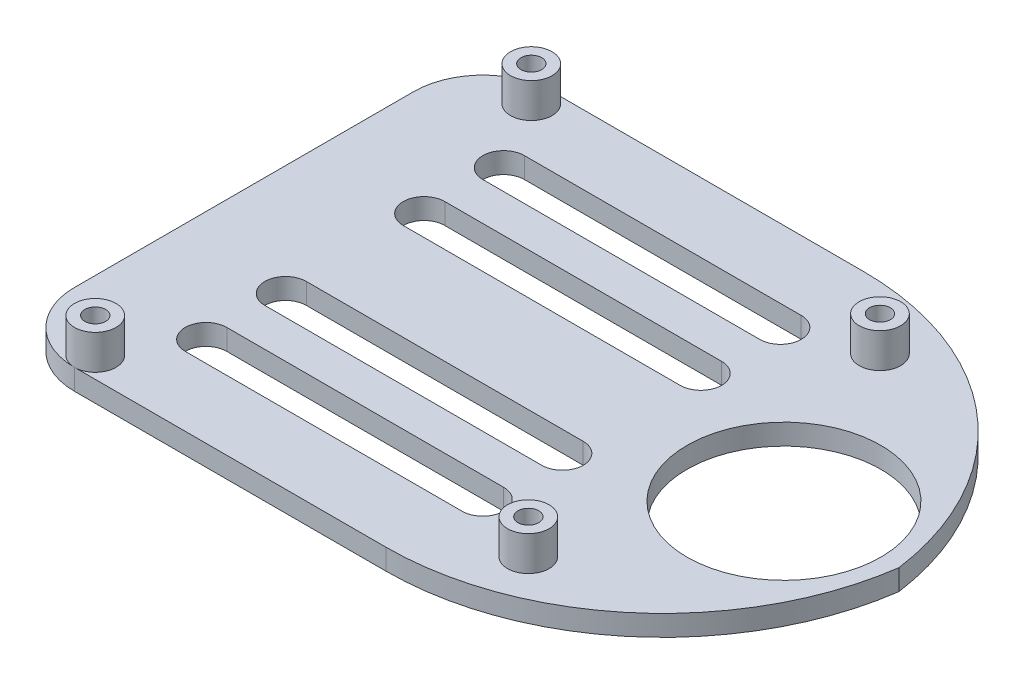
from build123d import *

# Parameters (mm, degrees)
ESBO_O1_W                = 95
ESBO_O1_H                = 69
RESSALTO_EXTRUS_O1_DEPTH = 3
ESBO_O2_R                = 14
CORTE_EXTRUS_O1_DEPTH    = 59.783501087
ESBO_O4_R                = 1
CORTE_EXTRUS_O2_DEPTH    = 59.783501087
ESBO_O5_R                = 3
ESBO_O5_R_2              = 1.5
RESSALTO_EXTRUS_O2_DEPTH = 5
FILETE1_R                = 40
FILETE2_R                = 10
CORTE_EXTRUS_O3_DEPTH    = 59.919436521


with BuildPart() as part:
    # Esboço1 → Ressalto-extrusão1 (new body)
    with BuildSketch(Plane(origin=(0, 0, 0), x_dir=(1, 0, 0), z_dir=(0, 1, 0))):
        Rectangle(ESBO_O1_W, ESBO_O1_H)
    extrude(amount=RESSALTO_EXTRUS_O1_DEPTH)

    # Esboço2 → Corte-extrusão1 (cut, through all)
    with BuildSketch(Plane(origin=(0, 3, 0), x_dir=(1, 0, 0), z_dir=(0, 1, 0))):
        with Locations(Location((30.5, 0, 0), (0, 0, 270))):
            Circle(ESBO_O2_R)
    extrude(amount=-CORTE_EXTRUS_O1_DEPTH, mode=Mode.SUBTRACT)

    # Esboço4 → Corte-extrusão2 (cut, through all)
    with BuildSketch(Plane(origin=(0, 3, 0), x_dir=(1, 0, 0), z_dir=(0, 1, 0))):
        with Locations(Location((18.971497235, 25.4, 0), (0, 0, 270))):
            Circle(ESBO_O4_R)
        with Locations(Location((18.971497235, -25.4, 0), (0, 0, 90))):
            Circle(ESBO_O4_R)
        with Locations(Location((-37.5, 31.5, 0), (0, 0, 270))):
            Circle(ESBO_O4_R)
        with Locations(Location((-37.5, -31.5, 0), (0, 0, 90))):
            Circle(ESBO_O4_R)
    extrude(amount=-CORTE_EXTRUS_O2_DEPTH, mode=Mode.SUBTRACT)

    # Esboço5 → Ressalto-extrusão2 (add)
    # profile 1 of 4: a face of its own
    with BuildSketch(Plane(origin=(0, 3, 0), x_dir=(1, 0, 0), z_dir=(0, 1, 0))):
        with Locations(Location((-37.5, 31.5, 0), (0, 0, 90))):
            Circle(ESBO_O5_R)
        with Locations(Location((-37.5, 31.5, 0), (0, 0, 270))):
            Circle(ESBO_O5_R_2, mode=Mode.SUBTRACT)
    # profile 2 of 4: a face of its own
    with BuildSketch(Plane(origin=(0, 3, 0), x_dir=(1, 0, 0), z_dir=(0, 1, 0))):
        with Locations(Location((18.971497235, 25.4, 0), (0, 0, 270))):
            Circle(ESBO_O5_R)
        with Locations(Location((18.971497235, 25.4, 0), (0, 0, 270))):
            Circle(ESBO_O5_R_2, mode=Mode.SUBTRACT)
    # profile 3 of 4: a face of its own
    with BuildSketch(Plane(origin=(0, 3, 0), x_dir=(1, 0, 0), z_dir=(0, 1, 0))):
        with Locations(Location((18.971497235, -25.4, 0), (0, 0, 90))):
            Circle(ESBO_O5_R)
        with Locations(Location((18.971497235, -25.4, 0), (0, 0, 90))):
            Circle(ESBO_O5_R_2, mode=Mode.SUBTRACT)
    # profile 4 of 4: a face of its own
    with BuildSketch(Plane(origin=(0, 3, 0), x_dir=(1, 0, 0), z_dir=(0, 1, 0))):
        with Locations(Location((-37.5, -31.5, 0), (0, 0, 90))):
            Circle(ESBO_O5_R)
        with Locations(Location((-37.5, -31.5, 0), (0, 0, 90))):
            Circle(ESBO_O5_R_2, mode=Mode.SUBTRACT)
    extrude(amount=RESSALTO_EXTRUS_O2_DEPTH)

    # Filete1
    # the kernel refuses this fillet: 40 mm, written as the material it takes off along each edge
    with BuildSketch(Plane(origin=(47.5, -100, -34.5), x_dir=(0, 0, 1), z_dir=(0, 1, 0)), Plane(origin=(47.5, -100, 34.5), x_dir=(-1, 0, 0), z_dir=(0, 1, 0))) as filete1_piece_1:
        with BuildLine():
            CenterArc((FILETE1_R, -FILETE1_R), FILETE1_R, 90, 90)
            Line((0, -FILETE1_R), (0, 0))
            Line((0, 0), (FILETE1_R, 0))
        make_face()
    extrude(amount=203, mode=Mode.SUBTRACT)

    # Filete2
    filete2_edges = [part.edges().sort_by_distance(p)[0] for p in [
        (-47.5, 1.5, 34.5),
        (-47.5, 1.5, -34.5),
    ]]
    fillet(filete2_edges, radius=FILETE2_R)

    # Esboço7 → Corte-extrusão3 (cut, through all)
    with BuildSketch(Plane(origin=(0, 3, 0), x_dir=(1, 0, 0), z_dir=(0, 1, 0))):
        with BuildLine():
            Line((-31.5, 13), (8.5, 13))
            ThreePointArc((8.5, 13), (11.5, 10), (8.5, 7))
            Line((8.5, 7), (-31.5, 7))
            ThreePointArc((-31.5, 7), (-34.5, 10), (-31.5, 13))
        make_face()
        with BuildLine():
            Line((-31.5, 24.5), (8.5, 24.5))
            ThreePointArc((8.5, 24.5), (11.5, 21.5), (8.5, 18.5))
            Line((8.5, 18.5), (-31.5, 18.5))
            ThreePointArc((-31.5, 18.5), (-34.5, 21.5), (-31.5, 24.5))
        make_face()
        with BuildLine():
            Line((-31.5, -24.5), (8.5, -24.5))
            ThreePointArc((8.5, -24.5), (11.5, -21.5), (8.5, -18.5))
            Line((8.5, -18.5), (-31.5, -18.5))
            ThreePointArc((-31.5, -18.5), (-34.5, -21.5), (-31.5, -24.5))
        make_face()
        with BuildLine():
            Line((-31.5, -13), (8.5, -13))
            ThreePointArc((8.5, -13), (11.5, -10), (8.5, -7))
            Line((8.5, -7), (-31.5, -7))
            ThreePointArc((-31.5, -7), (-34.5, -10), (-31.5, -13))
        make_face()
    extrude(amount=-CORTE_EXTRUS_O3_DEPTH, mode=Mode.SUBTRACT)


solid = part.part
